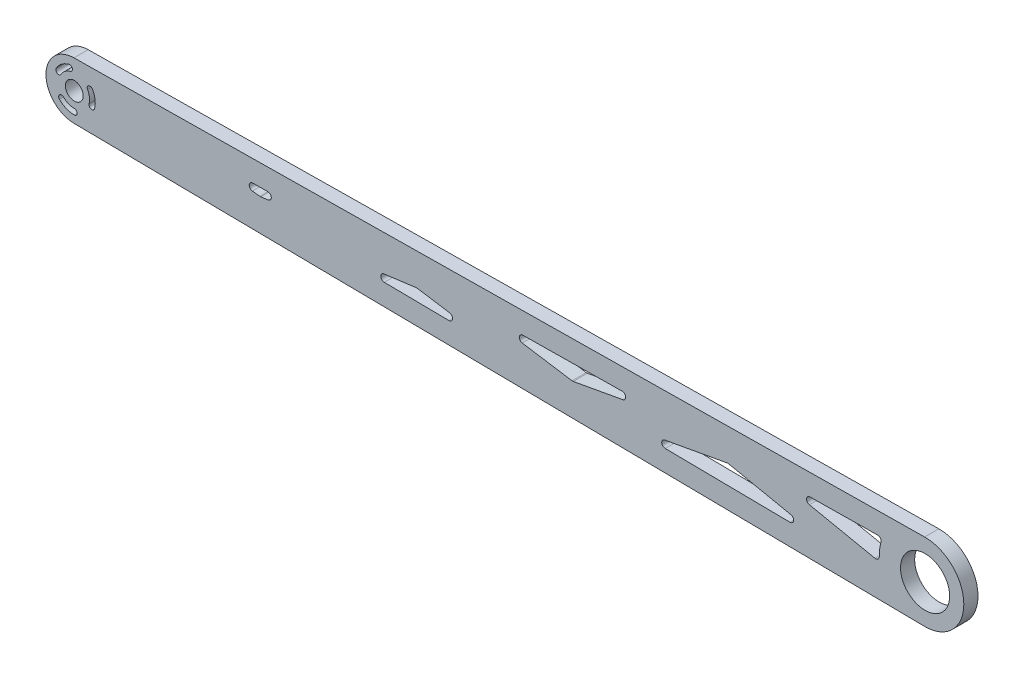
from build123d import *

# Parameters (mm, degrees)
SKETCH1_R               = 4
SKETCH1_R_2             = 11
BOSS_EXTRUDE1_DEPTH     = 6.35
CUT_EXTRUDE1_DEPTH      = 399.778218437
FILLET2_R               = 1.5875
CUT_EXTRUDE2_DEPTH      = 399.778218437
CUT_EXTRUDE2_DEPTH_BACK = 399.778218437


with BuildPart() as part:
    # Sketch1 → Boss-Extrude1 (new body)
    with BuildSketch(Plane.XY):
        with BuildLine():
            Line((380.788248031, 17.348707765), (-0.155, 12.699054099))
            ThreePointArc((-0.155, 12.699054099), (-12.7, 0), (-0.155, -12.699054099))
            Line((-0.155, -12.699054099), (380.788248031, -17.348707765))
            ThreePointArc((380.788248031, -17.348707765), (398.35, 0), (380.788248031, 17.348707765))
        make_face()
        Circle(SKETCH1_R, mode=Mode.SUBTRACT)
        with Locations((381, 0)):
            Circle(SKETCH1_R_2, mode=Mode.SUBTRACT)
    extrude(amount=BOSS_EXTRUDE1_DEPTH)

    # Sketch2 → Cut-Extrude1 (cut, through all)
    with BuildSketch(Plane.XY.offset(6.35)):
        Polygon((113.286813079, 4.557973813), (53.237992175, 3.825039913), (83.306199245, 0.603277026), align=None)
        Polygon((153.358754128, 0.236292705), (116.697733769, -4.59960626), (189.890819945, -5.492974244), align=None)
        Polygon((264.222978981, 6.400245334), (181.936651235, 5.395888576), (223.164863164, -1.069867649), align=None)
        Polygon((292.682933568, 1.896883496), (248.157073732, -6.204150783), (336.997801625, -7.288508147), align=None)
        with BuildLine():
            Line((361.931059508, 7.592834354), (314.902265737, 7.018818134))
            Line((314.902265737, 7.018818134), (360.62270169, -2.457913462))
            ThreePointArc((360.62270169, -2.457913462), (360.646724543, 2.649491118), (361.931059508, 7.592834354))
        make_face()
    extrude(amount=-CUT_EXTRUDE1_DEPTH, mode=Mode.SUBTRACT)

    # Fillet2
    fillet2_edges = [part.edges().sort_by_distance(p)[0] for p in [
        (336.997801625, -7.288508147, 3.175),
        (248.157073732, -6.204150783, 3.175),
        (292.682933568, 1.896883496, 3.175),
        (189.890819945, -5.492974244, 3.175),
        (116.697733769, -4.59960626, 3.175),
        (153.358754128, 0.236292705, 3.175),
        (264.222978981, 6.400245334, 3.175),
        (223.164863164, -1.069867649, 3.175),
        (181.936651235, 5.395888576, 3.175),
        (314.902265737, 7.018818134, 3.175),
        (361.931059508, 7.592834354, 3.175),
        (113.286813079, 4.557973813, 3.175),
        (83.306199245, 0.603277026, 3.175),
        (53.237992175, 3.825039913, 3.175),
        (360.62270169, -2.457913462, 3.175),
    ]]
    fillet(fillet2_edges, radius=FILLET2_R)

    # Sketch3 → Cut-Extrude2 (cut, two sides: drawn at the far end of the back side and taken through both)
    with BuildSketch(Plane.XY.offset(6.35).offset(-CUT_EXTRUDE2_DEPTH_BACK)):
        with BuildLine():
            ThreePointArc((-6.637962883, -6.637962883), (-3.592439625, -8.672916465), (0, -9.387497136))
            ThreePointArc((0, -9.387497136), (1.27, -8.117497136), (0, -6.847497136))
            ThreePointArc((0, -6.847497136), (-2.620423707, -6.326262453), (-4.841911659, -4.841911659))
            ThreePointArc((-4.841911659, -4.841911659), (-6.637962883, -4.841911659), (-6.637962883, -6.637962883))
        make_face()
        with BuildLine():
            ThreePointArc((-2.429663045, 9.067625928), (-5.714746171, 7.44760221), (-8.129810998, 4.693748568))
            ThreePointArc((-8.129810998, 4.693748568), (-7.664958735, 2.958896305), (-5.930106472, 3.423748568))
            ThreePointArc((-5.930106472, 3.423748568), (-4.168492142, 5.432484725), (-1.77226267, 6.614174329))
            ThreePointArc((-1.77226267, 6.614174329), (-0.874237058, 8.169600316), (-2.429663045, 9.067625928))
        make_face()
        with BuildLine():
            ThreePointArc((9.067625928, -2.429663045), (9.307185797, 1.225314256), (8.129810998, 4.693748568))
            ThreePointArc((8.129810998, 4.693748568), (6.394958735, 5.158600831), (5.930106472, 3.423748568))
            ThreePointArc((5.930106472, 3.423748568), (6.788915849, 0.893777727), (6.614174329, -1.77226267))
            ThreePointArc((6.614174329, -1.77226267), (7.512199941, -3.327688657), (9.067625928, -2.429663045))
        make_face()
    extrude(amount=CUT_EXTRUDE2_DEPTH + CUT_EXTRUDE2_DEPTH_BACK, mode=Mode.SUBTRACT)


solid = part.part
